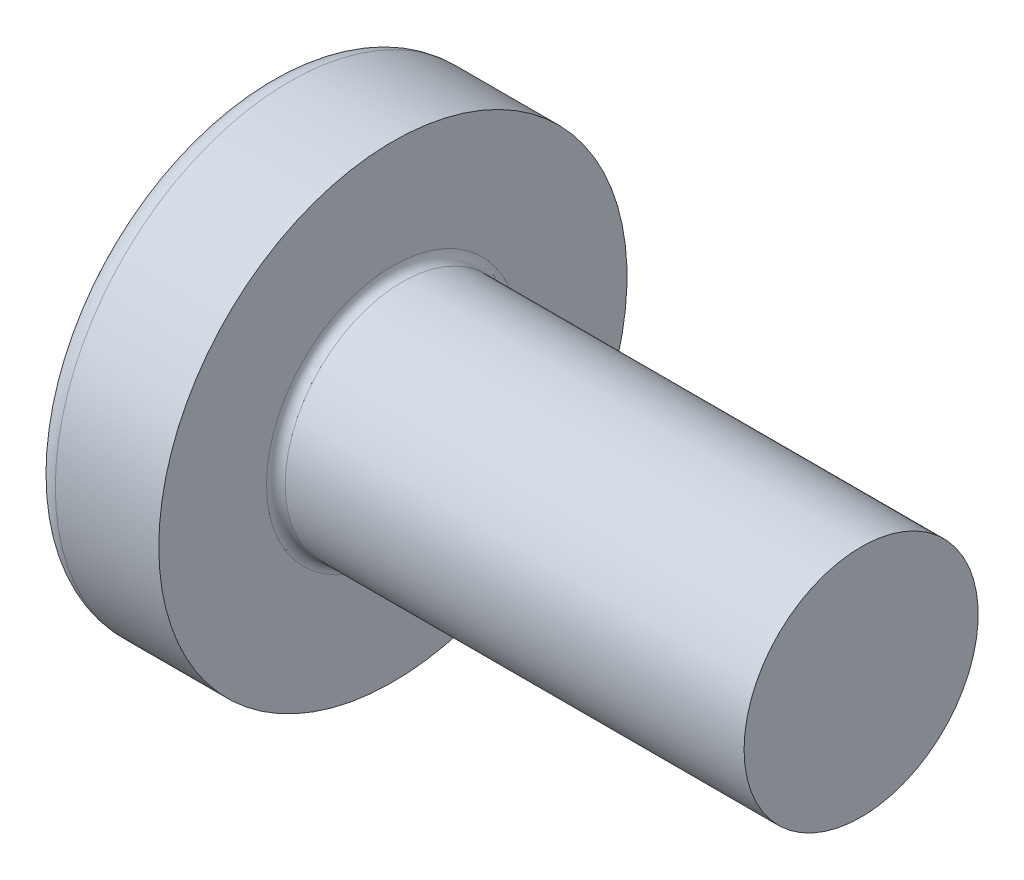
from build123d import *

# Parameters (mm, degrees)
RECPAT_COUNT = 2
RECPAT_ANGLE = 90


with BuildPart() as part:
    # Fillet1: read off the stored shape, not the designer's step
    # Fillet1 outline → Fillet1 (revolve)
    with BuildSketch(Plane.YX):
        with BuildLine():
            Line((1.25, 2.2), (1.25, 7.1))
            Line((1.25, 7.1), (0, 7.1))
            Line((0, 7.1), (0, 0))
            ThreePointArc((0, 0), (1.267435139, 0.206109099), (2.404255321, 0.803195916))
            ThreePointArc((2.404255321, 0.803195916), (2.474733878, 0.88781572), (2.5, 0.99500416))
            Line((2.5, 0.99500416), (2.5, 2.1))
            Line((2.5, 2.1), (1.35, 2.1))
            ThreePointArc((1.35, 2.1), (1.279289322, 2.129289322), (1.25, 2.2))
        make_face()
    revolve(axis=Axis((0, 0, 0), (1, 0, 0)))

    # Sketch3 → Recess section 0
    with BuildSketch(Plane(origin=(0, 0, 0), x_dir=(0, 0, -1), z_dir=(1, 0, 0))):
        with BuildLine():
            Line((0.37, -1.3), (-0.37, -1.3))
            Line((-0.37, -1.3), (-0.37, 1.3))
            Line((-0.37, 1.3), (0.37, 1.3))
            Line((0.37, 1.3), (0.37, -1.3))
        make_face()
    # Sketch4 → Recess section 1
    with BuildSketch(Plane(origin=(1.5, 0, 0), x_dir=(0, 0, -1), z_dir=(1, 0, 0))):
        with BuildLine():
            Line((0.37, -0.552127713), (-0.37, -0.552127713))
            Line((-0.37, -0.552127713), (-0.37, 0.552127713))
            Line((-0.37, 0.552127713), (0.37, 0.552127713))
            Line((0.37, 0.552127713), (0.37, -0.552127713))
        make_face()
    recess = loft(mode=Mode.SUBTRACT)

    # RecPat: Recess ×2 about axis
    recpat_axis = Axis((0, 0, 0), (1, 0, 0))
    for i in range(1, RECPAT_COUNT):
        add(recess.rotate(recpat_axis, i * RECPAT_ANGLE / (RECPAT_COUNT - 1)), mode=Mode.SUBTRACT)

    # RecCorSke → RecessCore (revolve, cut)
    with BuildSketch(Plane.XY, mode=Mode.PRIVATE) as recesscore_sk:
        Polygon((0, 0), (0, 0.660890218), (1.5, 0.556), (1.680655351, 0), align=None)
    revolve(recesscore_sk.sketch.rotate(Axis((-3.175, 0, 0), (1, 0, 0)), 90), axis=Axis((-3.175, 0, 0), (1, 0, 0)), mode=Mode.SUBTRACT)


solid = part.part
